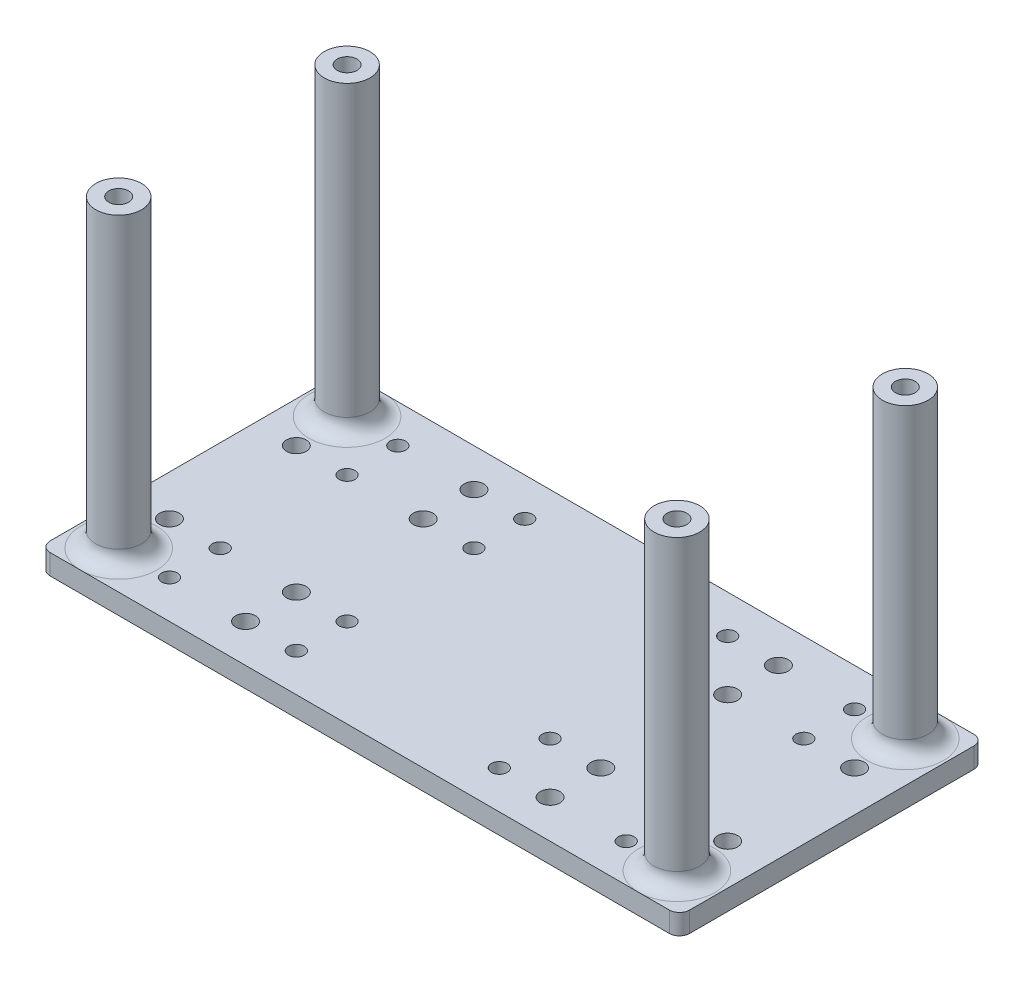
from build123d import *

# Parameters (mm, degrees)
SKETCH3_W                                    = 126
SKETCH3_H                                    = 60
BOSS_EXTRUDE1_DEPTH                          = 4
SKETCH4_R                                    = 1.95
SKETCH4_R_2                                  = 1.55
CUT_EXTRUDE1_DEPTH                           = 70.89277502
LPATTERN1_COUNT                              = 2
LPATTERN1_PITCH                              = 25
LPATTERN1_COUNT_DIR2                         = 2
LPATTERN1_PITCH_DIR2                         = 10
MIRROR1_COPY_1_SKETCH_R                      = 1.95
MIRROR1_COPY_1_SKETCH_R_2                    = 1.55
MIRROR1_COPY_1_DEPTH                         = 70.89277502
MIRROR1_COPY_2_SKETCH_R                      = 1.95
MIRROR1_COPY_2_SKETCH_R_2                    = 1.55
MIRROR1_COPY_2_DEPTH                         = 70.89277502
MIRROR1_COPY_3_SKETCH_R                      = 1.95
MIRROR1_COPY_3_SKETCH_R_2                    = 1.55
MIRROR1_COPY_3_DEPTH                         = 70.89277502
MIRROR1_AT_THE_SECOND_PLANE_COPY_1_SKETC_R   = 1.95
MIRROR1_AT_THE_SECOND_PLANE_COPY_1_SKETC_R_2 = 1.55
MIRROR1_AT_THE_SECOND_PLANE_COPY_1_DEPTH     = 70.89277502
MIRROR1_AT_THE_SECOND_PLANE_COPY_2_SKETC_R   = 1.95
MIRROR1_AT_THE_SECOND_PLANE_COPY_2_SKETC_R_2 = 1.55
MIRROR1_AT_THE_SECOND_PLANE_COPY_2_DEPTH     = 70.89277502
MIRROR1_AT_THE_SECOND_PLANE_COPY_3_SKETC_R   = 1.95
MIRROR1_AT_THE_SECOND_PLANE_COPY_3_SKETC_R_2 = 1.55
MIRROR1_AT_THE_SECOND_PLANE_COPY_3_DEPTH     = 70.89277502
MIRROR1_AT_THE_SECOND_PLANE_COPY_4_SKETC_R   = 1.95
MIRROR1_AT_THE_SECOND_PLANE_COPY_4_SKETC_R_2 = 1.55
MIRROR1_AT_THE_SECOND_PLANE_COPY_4_DEPTH     = 70.89277502
MIRROR1_AT_THE_SECOND_PLANE_COPY_5_SKETC_R   = 1.95
MIRROR1_AT_THE_SECOND_PLANE_COPY_5_SKETC_R_2 = 1.55
MIRROR1_AT_THE_SECOND_PLANE_COPY_5_DEPTH     = 70.89277502
MIRROR1_AT_THE_SECOND_PLANE_COPY_6_SKETC_R   = 1.95
MIRROR1_AT_THE_SECOND_PLANE_COPY_6_SKETC_R_2 = 1.55
MIRROR1_AT_THE_SECOND_PLANE_COPY_6_DEPTH     = 70.89277502
MIRROR1_AT_THE_SECOND_PLANE_COPY_7_SKETC_R   = 1.95
MIRROR1_AT_THE_SECOND_PLANE_COPY_7_SKETC_R_2 = 1.55
MIRROR1_AT_THE_SECOND_PLANE_COPY_7_DEPTH     = 70.89277502
FILLET1_R                                    = 2
BOSS_EXTRUDE2_START                          = 4
SKETCH5_R                                    = 4.5
BOSS_EXTRUDE2_DEPTH                          = 60
MIRROR2_START                                = 4
MIRROR2_AT_THE_SECOND_PLANE_COPY_1_SKETC_R   = 4.5
MIRROR2_AT_THE_SECOND_PLANE_COPY_1_DEPTH     = 60
FILLET2_R                                    = 3
CUT_EXTRUDE2_START                           = -10
SKETCH6_R                                    = 1.95
CUT_EXTRUDE2_DEPTH                           = 10
MIRROR3_START                                = -10
MIRROR3_AT_THE_SECOND_PLANE_COPY_1_SKETC_R   = 1.95
MIRROR3_AT_THE_SECOND_PLANE_COPY_1_DEPTH     = 10
SKETCH7_R                                    = 1.95
CUT_EXTRUDE3_DEPTH                           = 10


with BuildPart() as part:
    # Sketch3 → Boss-Extrude1 (new body)
    with BuildSketch(Plane(origin=(0, 0, 0), x_dir=(1, 0, 0), z_dir=(0, 1, 0))):
        Rectangle(SKETCH3_W, SKETCH3_H)
    extrude(amount=BOSS_EXTRUDE1_DEPTH)

    # Sketch4 → Cut-Extrude1 (cut, through all)
    with BuildSketch(Plane(origin=(0, 0, 0), x_dir=(1, 0, 0), z_dir=(0, 1, 0))):
        with Locations(Location((-55, 22.5, 0), (0, 0, 270))):
            Circle(SKETCH4_R)
        with Locations(Location((-45, 22.5, 0), (0, 0, 270))):
            Circle(SKETCH4_R_2)
    cut_extrude1 = extrude(amount=CUT_EXTRUDE1_DEPTH, mode=Mode.SUBTRACT)

    # LPattern1: Cut-Extrude1 2 × 2
    with Locations(*[(i * LPATTERN1_PITCH, 0, j * LPATTERN1_PITCH_DIR2) for i in range(LPATTERN1_COUNT) for j in range(LPATTERN1_COUNT_DIR2) if (i, j) != (0, 0)]):
        add(cut_extrude1, mode=Mode.SUBTRACT)

    # Mirror1: Cut-Extrude1 across plane
    add(cut_extrude1.mirror(Plane(origin=(0, 0, 0), x_dir=(0, 0, 1), z_dir=(1, 0, 0))), mode=Mode.SUBTRACT)

    # Mirror1 copy 1 sketch → Mirror1 copy 1 (cut, through all)
    with BuildSketch(Plane(origin=(0, 0, 10), x_dir=(-1, 0, 0), z_dir=(0, 1, 0))):
        with Locations((-55, -22.5)):
            Circle(MIRROR1_COPY_1_SKETCH_R)
        with Locations((-45, -22.5)):
            Circle(MIRROR1_COPY_1_SKETCH_R_2)
    extrude(amount=MIRROR1_COPY_1_DEPTH, mode=Mode.SUBTRACT)

    # Mirror1 copy 2 sketch → Mirror1 copy 2 (cut, through all)
    with BuildSketch(Plane(origin=(-25, 0, 0), x_dir=(-1, 0, 0), z_dir=(0, 1, 0))):
        with Locations((-55, -22.5)):
            Circle(MIRROR1_COPY_2_SKETCH_R)
        with Locations((-45, -22.5)):
            Circle(MIRROR1_COPY_2_SKETCH_R_2)
    extrude(amount=MIRROR1_COPY_2_DEPTH, mode=Mode.SUBTRACT)

    # Mirror1 copy 3 sketch → Mirror1 copy 3 (cut, through all)
    with BuildSketch(Plane(origin=(-25, 0, 10), x_dir=(-1, 0, 0), z_dir=(0, 1, 0))):
        with Locations((-55, -22.5)):
            Circle(MIRROR1_COPY_3_SKETCH_R)
        with Locations((-45, -22.5)):
            Circle(MIRROR1_COPY_3_SKETCH_R_2)
    extrude(amount=MIRROR1_COPY_3_DEPTH, mode=Mode.SUBTRACT)

    # Mirror1 at the second plane: Cut-Extrude1 across plane
    add(cut_extrude1.mirror(Plane.XY), mode=Mode.SUBTRACT)

    # Mirror1 at the second plane copy 1 sketc → Mirror1 at the second plane copy 1 (cut, through all)
    with BuildSketch(Plane(origin=(0, 0, -10), x_dir=(1, 0, 0), z_dir=(0, 1, 0))):
        with Locations((-55, -22.5)):
            Circle(MIRROR1_AT_THE_SECOND_PLANE_COPY_1_SKETC_R)
        with Locations((-45, -22.5)):
            Circle(MIRROR1_AT_THE_SECOND_PLANE_COPY_1_SKETC_R_2)
    extrude(amount=MIRROR1_AT_THE_SECOND_PLANE_COPY_1_DEPTH, mode=Mode.SUBTRACT)

    # Mirror1 at the second plane copy 2 sketc → Mirror1 at the second plane copy 2 (cut, through all)
    with BuildSketch(Plane(origin=(25, 0, 0), x_dir=(1, 0, 0), z_dir=(0, 1, 0))):
        with Locations((-55, -22.5)):
            Circle(MIRROR1_AT_THE_SECOND_PLANE_COPY_2_SKETC_R)
        with Locations((-45, -22.5)):
            Circle(MIRROR1_AT_THE_SECOND_PLANE_COPY_2_SKETC_R_2)
    extrude(amount=MIRROR1_AT_THE_SECOND_PLANE_COPY_2_DEPTH, mode=Mode.SUBTRACT)

    # Mirror1 at the second plane copy 3 sketc → Mirror1 at the second plane copy 3 (cut, through all)
    with BuildSketch(Plane(origin=(25, 0, -10), x_dir=(1, 0, 0), z_dir=(0, 1, 0))):
        with Locations((-55, -22.5)):
            Circle(MIRROR1_AT_THE_SECOND_PLANE_COPY_3_SKETC_R)
        with Locations((-45, -22.5)):
            Circle(MIRROR1_AT_THE_SECOND_PLANE_COPY_3_SKETC_R_2)
    extrude(amount=MIRROR1_AT_THE_SECOND_PLANE_COPY_3_DEPTH, mode=Mode.SUBTRACT)

    # Mirror1 at the second plane copy 4 sketc → Mirror1 at the second plane copy 4 (cut, through all)
    with BuildSketch(Plane(origin=(0, 0, 0), x_dir=(-1, 0, 0), z_dir=(0, 1, 0))):
        with Locations(Location((-55, 22.5, 0), (0, 0, 270))):
            Circle(MIRROR1_AT_THE_SECOND_PLANE_COPY_4_SKETC_R)
        with Locations(Location((-45, 22.5, 0), (0, 0, 270))):
            Circle(MIRROR1_AT_THE_SECOND_PLANE_COPY_4_SKETC_R_2)
    extrude(amount=MIRROR1_AT_THE_SECOND_PLANE_COPY_4_DEPTH, mode=Mode.SUBTRACT)

    # Mirror1 at the second plane copy 5 sketc → Mirror1 at the second plane copy 5 (cut, through all)
    with BuildSketch(Plane(origin=(0, 0, -10), x_dir=(-1, 0, 0), z_dir=(0, 1, 0))):
        with Locations(Location((-55, 22.5, 0), (0, 0, 270))):
            Circle(MIRROR1_AT_THE_SECOND_PLANE_COPY_5_SKETC_R)
        with Locations(Location((-45, 22.5, 0), (0, 0, 270))):
            Circle(MIRROR1_AT_THE_SECOND_PLANE_COPY_5_SKETC_R_2)
    extrude(amount=MIRROR1_AT_THE_SECOND_PLANE_COPY_5_DEPTH, mode=Mode.SUBTRACT)

    # Mirror1 at the second plane copy 6 sketc → Mirror1 at the second plane copy 6 (cut, through all)
    with BuildSketch(Plane(origin=(-25, 0, 0), x_dir=(-1, 0, 0), z_dir=(0, 1, 0))):
        with Locations(Location((-55, 22.5, 0), (0, 0, 270))):
            Circle(MIRROR1_AT_THE_SECOND_PLANE_COPY_6_SKETC_R)
        with Locations(Location((-45, 22.5, 0), (0, 0, 270))):
            Circle(MIRROR1_AT_THE_SECOND_PLANE_COPY_6_SKETC_R_2)
    extrude(amount=MIRROR1_AT_THE_SECOND_PLANE_COPY_6_DEPTH, mode=Mode.SUBTRACT)

    # Mirror1 at the second plane copy 7 sketc → Mirror1 at the second plane copy 7 (cut, through all)
    with BuildSketch(Plane(origin=(-25, 0, -10), x_dir=(-1, 0, 0), z_dir=(0, 1, 0))):
        with Locations(Location((-55, 22.5, 0), (0, 0, 270))):
            Circle(MIRROR1_AT_THE_SECOND_PLANE_COPY_7_SKETC_R)
        with Locations(Location((-45, 22.5, 0), (0, 0, 270))):
            Circle(MIRROR1_AT_THE_SECOND_PLANE_COPY_7_SKETC_R_2)
    extrude(amount=MIRROR1_AT_THE_SECOND_PLANE_COPY_7_DEPTH, mode=Mode.SUBTRACT)

    # Fillet1
    fillet1_edges = [part.edges().sort_by_distance(p)[0] for p in [
        (63, 2, 30),
        (-63, 2, 30),
        (-63, 2, -30),
        (63, 2, -30),
    ]]
    fillet(fillet1_edges, radius=FILLET1_R)

    # Sketch5 → Boss-Extrude2 (add)
    with BuildSketch(Plane(origin=(0, 0, 0), x_dir=(1, 0, 0), z_dir=(0, 1, 0)).offset(BOSS_EXTRUDE2_START)):
        with Locations(Location((-55, 22.5, 0), (0, 0, 90))):
            Circle(SKETCH5_R)
    boss_extrude2 = extrude(amount=BOSS_EXTRUDE2_DEPTH)

    # Mirror2: Boss-Extrude2 across plane
    add(boss_extrude2.mirror(Plane(origin=(0, 0, 0), x_dir=(0, 0, 1), z_dir=(1, 0, 0))))

    # Mirror2 at the second plane: Boss-Extrude2 across plane
    add(boss_extrude2.mirror(Plane.XY))

    # Mirror2 at the second plane copy 1 sketc → Mirror2 at the second plane copy 1 (add)
    with BuildSketch(Plane(origin=(0, 0, 0), x_dir=(-1, 0, 0), z_dir=(0, 1, 0)).offset(MIRROR2_START)):
        with Locations(Location((-55, 22.5, 0), (0, 0, 90))):
            Circle(MIRROR2_AT_THE_SECOND_PLANE_COPY_1_SKETC_R)
    extrude(amount=MIRROR2_AT_THE_SECOND_PLANE_COPY_1_DEPTH)

    # Fillet2
    fillet2_edges = [part.edges().sort_by_distance(p)[0] for p in [
        (-55, 4, -18),
        (-55, 4, 18),
        (55, 4, -18),
        (55, 4, 18),
    ]]
    fillet(fillet2_edges, radius=FILLET2_R - 0.0001)  # a hair under: the kernel refuses the full size

    # Sketch6 → Cut-Extrude2 (cut)
    with BuildSketch(Plane(origin=(0, 64, 0), x_dir=(1, 0, 0), z_dir=(0, 1, 0)).offset(CUT_EXTRUDE2_START)):
        with Locations(Location((-55, 22.5, 0), (0, 0, 90))):
            Circle(SKETCH6_R)
    cut_extrude2 = extrude(amount=CUT_EXTRUDE2_DEPTH, mode=Mode.SUBTRACT)

    # Mirror3: Cut-Extrude2 across plane
    add(cut_extrude2.mirror(Plane.XY), mode=Mode.SUBTRACT)

    # Mirror3 at the second plane: Cut-Extrude2 across plane
    add(cut_extrude2.mirror(Plane(origin=(0, 0, 0), x_dir=(0, 0, 1), z_dir=(1, 0, 0))), mode=Mode.SUBTRACT)

    # Mirror3 at the second plane copy 1 sketc → Mirror3 at the second plane copy 1 (cut)
    with BuildSketch(Plane(origin=(0, 64, 0), x_dir=(-1, 0, 0), z_dir=(0, 1, 0)).offset(MIRROR3_START)):
        with Locations(Location((-55, 22.5, 0), (0, 0, 90))):
            Circle(MIRROR3_AT_THE_SECOND_PLANE_COPY_1_SKETC_R)
    extrude(amount=MIRROR3_AT_THE_SECOND_PLANE_COPY_1_DEPTH, mode=Mode.SUBTRACT)

    # Sketch7 → Cut-Extrude3 (cut)
    with BuildSketch(Plane(origin=(0, 0, 0), x_dir=(1, 0, 0), z_dir=(0, 1, 0))):
        with Locations(Location((55, -22.5, 0), (0, 0, 90))):
            Circle(SKETCH7_R)
        with Locations(Location((55, 22.5, 0), (0, 0, 270))):
            Circle(SKETCH7_R)
        with Locations(Location((-55, -22.5, 0), (0, 0, 90))):
            Circle(SKETCH7_R)
        with Locations(Location((-55, 22.5, 0), (0, 0, 270))):
            Circle(SKETCH7_R)
    extrude(amount=CUT_EXTRUDE3_DEPTH, mode=Mode.SUBTRACT)


solid = part.part
